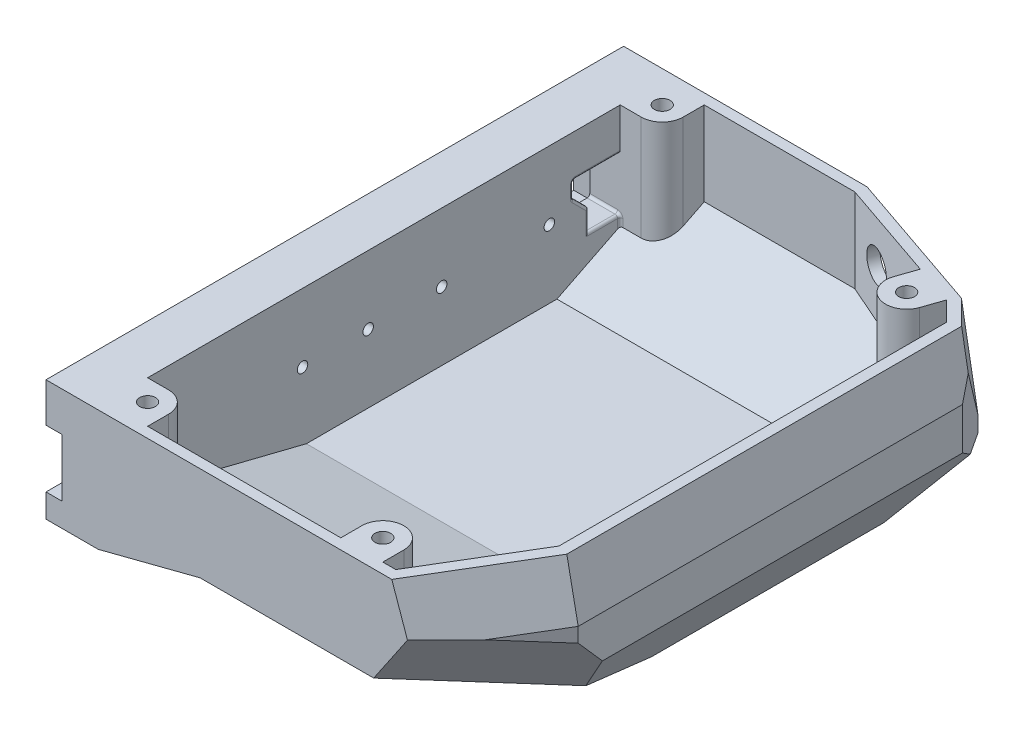
from build123d import *
from OCP.BRepFilletAPI import BRepFilletAPI_MakeChamfer

# Parameters (mm, degrees)
SKETCH1_W                 = 55
SKETCH1_H                 = 60
BOSS_EXTRUDE1_DEPTH       = 28
CHAMFER5_SIZE             = 15
CHAMFER5_SIZE2            = 9
CUT_EXTRUDE3_DEPTH        = 98.816154085
CUT_EXTRUDE5_DEPTH        = 98.816154085
CHAMFER2_SIZE             = 6
CHAMFER2_SIZE2            = 10
CHAMFER2_PART_2_SIZE      = 6
CHAMFER2_PART_2_SIZE2     = 10
CHAMFER3_SIZE             = 10
CHAMFER3_SIZE2            = 3
CHAMFER8_SIZE             = 3
CHAMFER8_SIZE2            = 4.688384964
CHAMFER8_SIZE2_2          = 4.826086957
SHELL1_T                  = -2
SKETCH1_3_W               = 9.35
SKETCH1_3_H               = 100
SKETCH1_3_H_2             = 10
BOSS_EXTRUDE2_DEPTH       = 28
CUT_EXTRUDE4_DEPTH        = 9.35
CUT_EXTRUDE6_DEPTH        = 98.816154085
CHAMFER6_SIZE             = 20
CHAMFER6_SIZE_2           = 5
SKETCH10_R                = 3
CUT_EXTRUDE7_DEPTH        = 2
BOSS_EXTRUDE3_REACH       = 80.678
SKETCH12_R                = 1.5
BOSS_EXTRUDE4_REACH       = 80.678
SKETCH12_4_R              = 1.5
BOSS_EXTRUDE5_REACH       = 80.678
SKETCH12_5_R              = 1.5
CUT_EXTRUDE8_DEPTH        = 3.55
SKETCH15_R                = 1
SKETCH15_R_2              = 2
CUT_EXTRUDE9_DEPTH        = 1
SKETCH15_3_R              = 1
CUT_EXTRUDE10_DEPTH       = 5.8
CUT_EXTRUDE11_DEPTH       = 3
SKETCH16_W                = 6
SKETCH16_H                = 10
CUT_EXTRUDE12_DEPTH       = 6
CUT_EXTRUDE13_DEPTH       = 90.5
CUT_EXTRUDE13_DEPTH_BACK  = 0.5
SKETCH17_W                = 3.55
SKETCH17_H                = 0.5
CUT_EXTRUDE14_DEPTH       = 5.8
FILLET1_R                 = 0.5
CUT_EXTRUDE15_START       = -1
CUT_EXTRUDE15_OUTLINE_R   = 2.5
CUT_EXTRUDE15_OUTLINE_R_2 = 2
CUT_EXTRUDE15_DEPTH       = 1


# Read off the part's stored shape, not the designer's step: Cut-Extrude15
with BuildPart() as part:
    # Sketch1 → Boss-Extrude1 (new body)
    # profile 1 of 2: a face of its own
    with BuildSketch(Plane(origin=(0, 0, 0), x_dir=(1, 0, 0), z_dir=(0, 1, 0))):
        Polygon((29.5, 50), (-7.5, 50), (-42.5, 38), (-42.5, -40), (-30.5, -60), (29.5, -60), (29.5, -50), align=None)
        Rectangle(SKETCH1_W, SKETCH1_H, mode=Mode.SUBTRACT)
    # profile 2 of 2: a face of its own
    with BuildSketch(Plane(origin=(0, 0, 0), x_dir=(1, 0, 0), z_dir=(0, 1, 0))):
        Rectangle(SKETCH1_W, SKETCH1_H)
    extrude(amount=BOSS_EXTRUDE1_DEPTH)

    # Chamfer5
    chamfer5_edges = [part.edges().sort_by_distance(p)[0] for p in [
        (-25, 0, -44),
    ]]
    chamfer5_side = [part.faces().sort_by_distance(p)[0] for p in [
        (-5.320816864, 0, 5.646903821),
    ]]
    chamfer(chamfer5_edges, length=CHAMFER5_SIZE, length2=CHAMFER5_SIZE2, reference=chamfer5_side[0])

    # Sketch6 → Cut-Extrude3 (cut, through all)
    with BuildSketch(Plane(origin=(29.5, 0, 0), x_dir=(0, 0, -1), z_dir=(1, 0, 0))):
        Polygon((28.599998808, 0.090000199), (38.599998808, 5.090000199), (50, 10.790000795), (50, 0), (28.41999841, 0), align=None)
    extrude(amount=-CUT_EXTRUDE3_DEPTH, mode=Mode.SUBTRACT)

    # Sketch8 → Cut-Extrude5 (cut, through all)
    with BuildSketch(Plane.ZY.offset(42.5)):
        Polygon((20, 0), (60, 10), (60, 0), align=None)
    extrude(amount=-CUT_EXTRUDE5_DEPTH, mode=Mode.SUBTRACT)

    # Chamfer2
    chamfer2_edges = [part.edges().sort_by_distance(p)[0] for p in [
        (-42.5, 0, -1.071428571),
    ]]
    chamfer2_side = [part.faces().sort_by_distance(p)[0] for p in [
        (-5.998960327, 0, -3.839335876),
    ]]
    chamfer(chamfer2_edges, length=CHAMFER2_SIZE, length2=CHAMFER2_SIZE2, reference=chamfer2_side[0])

    # Chamfer2 part 2
    chamfer2_part_2_edges = [part.edges().sort_by_distance(p)[0] for p in [
        (-36.5, 7.5, 50),
    ]]
    chamfer2_part_2_side = [part.faces().sort_by_distance(p)[0] for p in [
        (-5.108695652, 4.855072464, 39.420289855),
    ]]
    chamfer(chamfer2_part_2_edges, length=CHAMFER2_PART_2_SIZE, length2=CHAMFER2_PART_2_SIZE2, reference=chamfer2_part_2_side[0])

    # Chamfer3: one chamfer whose edges measure the first distance from different faces: ONE call of the kernel's chamfer builder (chamfer() names one face for all edges)
    chamfer3_edges_1 = [part.edges().sort_by_distance(p)[0] for p in [
        (-36.5, 28, 50),
    ]]
    chamfer3_side_1 = [part.faces().sort_by_distance(p)[0] for p in [
        (-36.986722145, 22.762198781, 49.188796426),
    ]]
    chamfer3_edges_2 = [part.edges().sort_by_distance(p)[0] for p in [
        (-42.5, 28, 1),
    ]]
    chamfer3_side_2 = [part.faces().sort_by_distance(p)[0] for p in [
        (-42.5, 19.062821539, 0.675718674),
    ]]
    chamfer3 = BRepFilletAPI_MakeChamfer(part.part.solid().wrapped)
    for e in chamfer3_edges_1:
        chamfer3.Add(CHAMFER3_SIZE, CHAMFER3_SIZE2, e.wrapped, chamfer3_side_1[0].wrapped)  # the first distance lies on this face
    for e in chamfer3_edges_2:
        chamfer3.Add(CHAMFER3_SIZE, CHAMFER3_SIZE2, e.wrapped, chamfer3_side_2[0].wrapped)  # the first distance lies on this face
    add(Compound.cast(chamfer3.Shape()), mode=Mode.REPLACE)

    # Chamfer8: one chamfer whose edges measure the first distance from different faces: ONE call of the kernel's chamfer builder (chamfer() names one face for all edges)
    chamfer8_edges_1 = [part.edges().sort_by_distance(p)[0] for p in [
        (-41, 23, -38.514285714),
    ]]
    chamfer8_side_1 = [part.faces().sort_by_distance(p)[0] for p in [
        (-40.999367405, 23.002108649, 0.534923115),
    ]]
    chamfer8_edges_2 = [part.edges().sort_by_distance(p)[0] for p in [
        (-42.5, 14, -38),
    ]]
    chamfer8_side_2 = [part.faces().sort_by_distance(p)[0] for p in [
        (-24.809989525, 18.489778037, -44.065146449),
    ]]
    chamfer8 = BRepFilletAPI_MakeChamfer(part.part.solid().wrapped)
    for e in chamfer8_edges_1:
        chamfer8.Add(CHAMFER8_SIZE, CHAMFER8_SIZE2, e.wrapped, chamfer8_side_1[0].wrapped)  # the first distance lies on this face
    for e in chamfer8_edges_2:
        chamfer8.Add(CHAMFER8_SIZE, CHAMFER8_SIZE2_2, e.wrapped, chamfer8_side_2[0].wrapped)  # the first distance lies on this face
    add(Compound.cast(chamfer8.Shape()), mode=Mode.REPLACE)

    # Shell1
    shell1_openings = [part.faces().sort_by_distance(p)[0] for p in [
        (-3.850715667, 28, 5.420818652),
        (29.5, 15.210219058, 3.998585691),
    ]]
    offset(amount=SHELL1_T, openings=shell1_openings, kind=Kind.INTERSECTION)

    # Sketch1<3> → Boss-Extrude2 (add)
    with BuildSketch(Plane(origin=(0, 0, 0), x_dir=(1, 0, 0), z_dir=(0, 1, 0))):
        with Locations((34.175, 0)):
            Rectangle(SKETCH1_3_W, SKETCH1_3_H)
        with Locations((34.175, -55)):
            Rectangle(SKETCH1_3_W, SKETCH1_3_H_2)
    extrude(amount=BOSS_EXTRUDE2_DEPTH)

    # Sketch7 → Cut-Extrude4 (cut)
    with BuildSketch(Plane.ZY.offset(-29.5)):
        Polygon((-28.41999841, 0), (-50, 10.790000795), (-50, 0), align=None)
    extrude(amount=-CUT_EXTRUDE4_DEPTH, mode=Mode.SUBTRACT)

    # Sketch9 → Cut-Extrude6 (cut, through all)
    with BuildSketch(Plane.ZY.offset(-29.5)):
        Polygon((60, 0), (60, 5), (35, 0), align=None)
    extrude(amount=-CUT_EXTRUDE6_DEPTH, mode=Mode.SUBTRACT)

    # Chamfer6
    # the kernel refuses this chamfer: 20, 5 mm, written as the material it adds along each edge
    with BuildSketch(Plane(origin=(29.5, -12.597918829, -30.391675317), x_dir=(-0.9999563942249224, 0.009059783074481399, -0.0022649457686203496), z_dir=(0, 0.24253562503633297, 0.9701425001453319))) as chamfer6_piece_1_section:
        Polygon((CHAMFER6_SIZE * 0.999956394225, CHAMFER6_SIZE * 0.00933861064032), (-CHAMFER6_SIZE_2 * 0.00933861064032, CHAMFER6_SIZE_2 * 0.999956394225), (0, 0), align=None)
    chamfer6_piece_1 = extrude(amount=145.116156247, mode=Mode.PRIVATE)
    chamfer6_piece_1 = split(chamfer6_piece_1, bisect_by=Plane(origin=(21.891274925, 0, 42.504406507), z_dir=(0, 1, 0)), keep=Keep.TOP, mode=Mode.PRIVATE)
    chamfer6_piece_1 = split(chamfer6_piece_1, bisect_by=Plane(origin=(21.891274925, 4.42094487, 60), z_dir=(0, 0, -1)), keep=Keep.TOP, mode=Mode.PRIVATE)
    chamfer6_piece_1 = split(chamfer6_piece_1, bisect_by=Plane(origin=(21.891274925, 1.613191439, 43.065957193), z_dir=(0, 0.9805806756909202, -0.19611613513818396)), keep=Keep.TOP, mode=Mode.PRIVATE)
    add(chamfer6_piece_1)

    # Sketch10 → Cut-Extrude7 (cut)
    with BuildSketch(Plane(origin=(-16.128560993, 0, -47.041636231), x_dir=(-0.9459459459459459, 0, 0.3243243243243241), z_dir=(-0.3243243243243242, 0, -0.945945945945946))):
        with Locations((-2.121621622, 20)):
            Circle(SKETCH10_R)
    extrude(amount=-CUT_EXTRUDE7_DEPTH, mode=Mode.SUBTRACT)

    # Boss-Extrude3: up to this plane
    boss_extrude3_end = Plane(origin=(29.5, 1.940285, 19.51492875), z_dir=(0, 0.9701425001453319, -0.24253562503633297))
    # Sketch12 → Boss-Extrude3 (add, up to the surface)
    with BuildSketch(Plane(origin=(0, 28, 0), x_dir=(1, 0, 0), z_dir=(0, 1, 0)), mode=Mode.PRIVATE) as boss_extrude3_sk1:
        with BuildLine():
            Line((21.5, -58), (29.5, -58))
            Line((29.5, -58), (29.5, -50))
            Line((29.5, -50), (25.5, -50))
            ThreePointArc((25.5, -50), (22.671572875, -51.171572875), (21.5, -54))
            Line((21.5, -54), (21.5, -58))
        make_face()
        with Locations(Location((25.5, -54, 0), (0, 0, 270))):
            Circle(SKETCH12_R, mode=Mode.SUBTRACT)
    boss_extrude3_tool1 = split(extrude(boss_extrude3_sk1.sketch, amount=-BOSS_EXTRUDE3_REACH, mode=Mode.PRIVATE), bisect_by=boss_extrude3_end, keep=Keep.BOTH, mode=Mode.PRIVATE)
    add(boss_extrude3_tool1.solids().sort_by_distance((25.5, 28, 57.886863))[0])
    # Sketch12 → Boss-Extrude3 (add, up to the surface)
    with BuildSketch(Plane(origin=(0, 28, 0), x_dir=(1, 0, 0), z_dir=(0, 1, 0)), mode=Mode.PRIVATE) as boss_extrude3_sk2:
        with BuildLine():
            Line((-23.291144984, -58), (-15.291144984, -58))
            Line((-15.291144984, -58), (-15.291144984, -54))
            ThreePointArc((-15.291144984, -54), (-19.291144984, -50), (-23.291144984, -54))
            Line((-23.291144984, -54), (-23.291144984, -58))
        make_face()
        with Locations(Location((-19.291144984, -54, 0), (0, 0, 270))):
            Circle(SKETCH12_R, mode=Mode.SUBTRACT)
    boss_extrude3_tool2 = split(extrude(boss_extrude3_sk2.sketch, amount=-BOSS_EXTRUDE3_REACH, mode=Mode.PRIVATE), bisect_by=boss_extrude3_end, keep=Keep.BOTH, mode=Mode.PRIVATE)
    add(boss_extrude3_tool2.solids().sort_by_distance((-23.178008, 28, 56))[0])

    # Boss-Extrude4: up to this plane
    boss_extrude4_end = Plane(origin=(-42.5, 1.878854581, -27.705571617), z_dir=(0, 0.8944271909999164, 0.44721359549995693))
    # Sketch12<4> → Boss-Extrude4 (add, up to the surface)
    with BuildSketch(Plane(origin=(0, 28, 0), x_dir=(1, 0, 0), z_dir=(0, 1, 0)), mode=Mode.PRIVATE) as boss_extrude4_sk1:
        with BuildLine():
            Line((29.5, 40), (29.5, 48))
            Line((29.5, 48), (21.5, 48))
            Line((21.5, 48), (21.5, 44))
            ThreePointArc((21.5, 44), (22.671572875, 41.171572875), (25.5, 40))
            Line((25.5, 40), (29.5, 40))
        make_face()
        with Locations(Location((25.5, 44, 0), (0, 0, 270))):
            Circle(SKETCH12_4_R, mode=Mode.SUBTRACT)
    boss_extrude4_tool1 = split(extrude(boss_extrude4_sk1.sketch, amount=-BOSS_EXTRUDE4_REACH, mode=Mode.PRIVATE), bisect_by=boss_extrude4_end, keep=Keep.BOTH, mode=Mode.PRIVATE)
    add(boss_extrude4_tool1.solids().sort_by_distance((22.751573, 28, -41.251573))[0])

    # Boss-Extrude5: up to this plane
    boss_extrude5_end = Plane(origin=(-15.794834017, 10.714985851, -46.068265883), z_dir=(0.16686348824676464, 0.8574929257125453, 0.4866851740530639))
    # Sketch12<5> → Boss-Extrude5 (add, up to the surface)
    with BuildSketch(Plane(origin=(0, 28, 0), x_dir=(1, 0, 0), z_dir=(0, 1, 0)), mode=Mode.PRIVATE) as boss_extrude5_sk1:
        with BuildLine():
            Line((-26.156435162, 41.48922223), (-33.72400273, 38.894627636))
            Line((-33.72400273, 38.894627636), (-32.426705432, 35.110843852))
            ThreePointArc((-32.426705432, 35.110843852), (-30.401133137, 32.815274277), (-27.34562442, 32.624357342))
            ThreePointArc((-27.34562442, 32.624357342), (-25.050054776, 34.649929661), (-24.859137865, 37.705438446))
            Line((-24.859137865, 37.705438446), (-26.156435162, 41.48922223))
        make_face()
        with Locations(Location((-28.642921649, 36.408141149, 0), (0, 0, 270))):
            Circle(SKETCH12_5_R, mode=Mode.SUBTRACT)
    boss_extrude5_tool1 = split(extrude(boss_extrude5_sk1.sketch, amount=-BOSS_EXTRUDE5_REACH, mode=Mode.PRIVATE), bisect_by=boss_extrude5_end, keep=Keep.BOTH, mode=Mode.PRIVATE)
    add(boss_extrude5_tool1.solids().sort_by_distance((-25.62927, 28, -39.555679))[0])

    # Sketch14 → Cut-Extrude8 (cut)
    with BuildSketch(Plane(origin=(38.85, 0, 0), x_dir=(0, 0, -1), z_dir=(1, 0, 0))):
        Polygon((-50, 20), (-50, 20.5), (40, 20.5), (40, 20), (40, 10), (40, 9.5), (-50, 9.5), (-50, 10), align=None)
    extrude(amount=-CUT_EXTRUDE8_DEPTH, mode=Mode.SUBTRACT)

    # Sketch15 → Cut-Extrude9 (cut)
    # profile 1 of 5: a face of its own
    with BuildSketch(Plane(origin=(35.3, 0, 0), x_dir=(0, 0, -1), z_dir=(1, 0, 0))):
        with BuildLine():
            Line((13, 10), (26, 10))
            Line((26, 10), (26, 13.063508327))
            ThreePointArc((26, 13.063508327), (28.5, 15), (26, 16.936491673))
            Line((26, 16.936491673), (26, 20))
            Line((26, 20), (13, 20))
            Line((13, 20), (13, 10))
        make_face()
    # profile 2 of 5: a face of its own
    with BuildSketch(Plane(origin=(35.3, 0, 0), x_dir=(0, 0, -1), z_dir=(1, 0, 0))):
        with BuildLine():
            Line((-43.5, 10), (-20, 10))
            Line((-20, 10), (-20, 13.063508327))
            ThreePointArc((-20, 13.063508327), (-18.5, 15), (-20, 16.936491673))
            Line((-20, 16.936491673), (-20, 20))
            Line((-20, 20), (-43.5, 20))
            Line((-43.5, 20), (-43.5, 10))
        make_face()
        with Locations((-20.5, 15)):
            Circle(SKETCH15_R, mode=Mode.SUBTRACT)
    # profile 3 of 5: a face of its own
    with BuildSketch(Plane(origin=(35.3, 0, 0), x_dir=(0, 0, -1), z_dir=(1, 0, 0))):
        with Locations((-46, 15)):
            Circle(SKETCH15_R_2)
        with Locations((-46, 15)):
            Circle(SKETCH15_R, mode=Mode.SUBTRACT)
    # profile 4 of 5: a face of its own
    with BuildSketch(Plane(origin=(35.3, 0, 0), x_dir=(0, 0, -1), z_dir=(1, 0, 0))):
        with Locations((-8, 15)):
            Circle(SKETCH15_R_2)
        with Locations((-8, 15)):
            Circle(SKETCH15_R, mode=Mode.SUBTRACT)
    # profile 5 of 5: a face of its own
    with BuildSketch(Plane(origin=(35.3, 0, 0), x_dir=(0, 0, -1), z_dir=(1, 0, 0))):
        with Locations((6, 15)):
            Circle(SKETCH15_R_2)
        with Locations((6, 15)):
            Circle(SKETCH15_R, mode=Mode.SUBTRACT)
    extrude(amount=-CUT_EXTRUDE9_DEPTH, mode=Mode.SUBTRACT)

    # Sketch15<3> → Cut-Extrude10 (cut)
    with BuildSketch(Plane(origin=(35.3, 0, 0), x_dir=(0, 0, -1), z_dir=(1, 0, 0))):
        with BuildLine():
            ThreePointArc((26, 15.866025404), (25.5, 15), (26, 14.133974596))
            Line((26, 14.133974596), (26, 15.866025404))
        make_face()
        with BuildLine():
            Line((26, 15.866025404), (26, 14.133974596))
            ThreePointArc((26, 14.133974596), (27, 14.133974596), (27.5, 15))
            ThreePointArc((27.5, 15), (27, 15.866025404), (26, 15.866025404))
        make_face()
        with Locations((6, 15)):
            Circle(SKETCH15_3_R)
        with Locations((-8, 15)):
            Circle(SKETCH15_3_R)
        with BuildLine():
            ThreePointArc((-20, 15.866025404), (-21.5, 15), (-20, 14.133974596))
            Line((-20, 14.133974596), (-20, 15.866025404))
        make_face()
        with BuildLine():
            Line((-20, 15.866025404), (-20, 14.133974596))
            ThreePointArc((-20, 14.133974596), (-19.633974596, 14.5), (-19.5, 15))
            ThreePointArc((-19.5, 15), (-19.633974596, 15.5), (-20, 15.866025404))
        make_face()
        with Locations((-46, 15)):
            Circle(SKETCH15_3_R)
    extrude(amount=-CUT_EXTRUDE10_DEPTH, mode=Mode.SUBTRACT)

    # Sketch14<3> → Cut-Extrude11 (cut)
    with BuildSketch(Plane(origin=(38.85, 0, 0), x_dir=(0, 0, -1), z_dir=(1, 0, 0))):
        Polygon((-60, 9.5), (-50, 9.5), (-50, 10), (-50, 20), (-50, 20.5), (-60, 20.5), align=None)
    extrude(amount=-CUT_EXTRUDE11_DEPTH, mode=Mode.SUBTRACT)


with BuildPart() as body_2:
    # Mirror1: mirrored copy
    add(part.part.mirror(Plane(origin=(48.85, 0, 0), x_dir=(0, 0, 1), z_dir=(1, 0, 0))))

    # Sketch16 → Cut-Extrude12 (cut)
    with BuildSketch(Plane.ZY.offset(-62.4)):
        with Locations((-37, 15)):
            Rectangle(SKETCH16_W, SKETCH16_H)
    extrude(amount=-CUT_EXTRUDE12_DEPTH, mode=Mode.SUBTRACT)

    # Sketch17 → Cut-Extrude13 (cut, two sides: drawn at the far end of the back side and taken through both)
    with BuildSketch(Plane.XY.offset(-40).offset(-CUT_EXTRUDE13_DEPTH_BACK)):
        with Locations((60.625, 9.25)):
            Rectangle(SKETCH17_W, SKETCH17_H)
        Polygon((58.85, 20.5), (58.85, 9.5), (62.4, 9.5), (62.4, 10), (62.4, 20), (62.4, 20.5), align=None)
        with Locations((60.625, 20.75)):
            Rectangle(SKETCH17_W, SKETCH17_H)
    extrude(amount=CUT_EXTRUDE13_DEPTH + CUT_EXTRUDE13_DEPTH_BACK, mode=Mode.SUBTRACT)

    # Sketch18 → Cut-Extrude14 (cut)
    with BuildSketch(Plane.ZY.offset(-62.4)):
        Polygon((-31, 20), (-34, 20), (-34, 14), (-31, 17), align=None)
    extrude(amount=-CUT_EXTRUDE14_DEPTH, mode=Mode.SUBTRACT)

    # Fillet1
    fillet1_edges = [body_2.edges().sort_by_distance(p)[0] for p in [
        (68.2, 9.013034386, -40),
        (68.2, 20, -35.5),
        (68.2, 10, -37),
        (68.2, 12, -34),
        (68.2, 15.5, -32.5),
        (62.4, 20, -35.5),
        (62.4, 15.5, -32.5),
        (68.2, 18.5, -31),
        (65.3, 20, -31),
        (62.4, 18.5, -31),
        (65.3, 17, -31),
        (65.3, 14, -34),
        (65.3, 10, -40),
    ]]
    fillet(fillet1_edges, radius=FILLET1_R)

    # Cut-Extrude15 outline → Cut-Extrude15 (cut)
    # profile 1 of 5: a face of its own
    with BuildSketch(Plane.ZY.offset(-62.4).offset(CUT_EXTRUDE15_START)):
        with Locations((-6, 15)):
            Circle(CUT_EXTRUDE15_OUTLINE_R)
        with Locations((-6, 15)):
            Circle(CUT_EXTRUDE15_OUTLINE_R_2, mode=Mode.SUBTRACT)
    # profile 2 of 5: a face of its own
    with BuildSketch(Plane.ZY.offset(-62.4).offset(CUT_EXTRUDE15_START)):
        with BuildLine():
            Line((-31, 14), (-28.791287847, 14))
            ThreePointArc((-28.791287847, 14), (-27.652142859, 12.781314165), (-26, 12.550510257))
            Line((-26, 12.550510257), (-26, 13.063508327))
            ThreePointArc((-26, 13.063508327), (-28.5, 15), (-26, 16.936491673))
            Line((-26, 16.936491673), (-26, 17.449489743))
            ThreePointArc((-26, 17.449489743), (-27.652142859, 17.218685835), (-28.791287847, 16))
            Line((-28.791287847, 16), (-31, 16))
            ThreePointArc((-31, 16), (-32, 15), (-31, 14))
        make_face()
    # profile 3 of 5: a face of its own
    with BuildSketch(Plane.ZY.offset(-62.4).offset(CUT_EXTRUDE15_START)):
        with BuildLine():
            Line((43.5, 15.502493781), (43.5, 14.497506219))
            ThreePointArc((43.5, 14.497506219), (48.55, 15), (43.5, 15.502493781))
        make_face()
        with Locations((46, 15)):
            Circle(CUT_EXTRUDE15_OUTLINE_R_2, mode=Mode.SUBTRACT)
    # profile 4 of 5: a face of its own
    with BuildSketch(Plane.ZY.offset(-62.4).offset(CUT_EXTRUDE15_START)):
        with Locations((8, 15)):
            Circle(CUT_EXTRUDE15_OUTLINE_R)
        with Locations((8, 15)):
            Circle(CUT_EXTRUDE15_OUTLINE_R_2, mode=Mode.SUBTRACT)
    # profile 5 of 5: a face of its own
    with BuildSketch(Plane.ZY.offset(-62.4).offset(CUT_EXTRUDE15_START)):
        with BuildLine():
            Line((20, 16.936491673), (20, 17.449489743))
            ThreePointArc((20, 17.449489743), (18, 15), (20, 12.550510257))
            Line((20, 12.550510257), (20, 13.063508327))
            ThreePointArc((20, 13.063508327), (18.5, 15), (20, 16.936491673))
        make_face()
    extrude(amount=CUT_EXTRUDE15_DEPTH, mode=Mode.SUBTRACT)


solid = body_2.part
